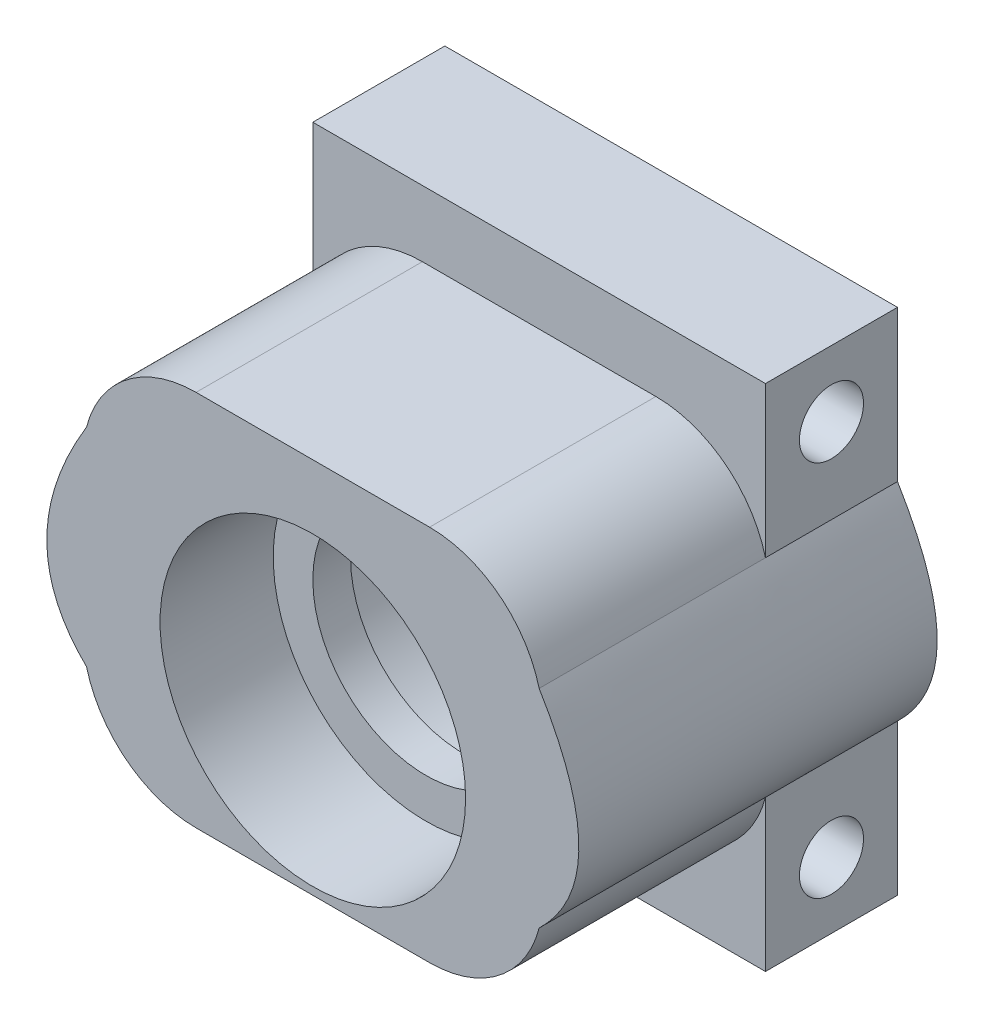
from build123d import *

# Parameters (mm, degrees)
SKETCH1_W            = 24
SKETCH1_H            = 3.5
SKETCH1_R            = 8.1
BOSS_EXTRUDE1_DEPTH  = 7
BOSS_EXTRUDE2_START  = 7
SKETCH1_3_R          = 8.1
BOSS_EXTRUDE2_DEPTH  = 12
M3_CLEARANCE_HOLE1_D = 3.4
FILLET1_R            = 6
BOSS_EXTRUDE3_START  = 11
SKETCH1_4_R          = 8.1
SKETCH1_4_R_2        = 6
BOSS_EXTRUDE3_DEPTH  = 2


with BuildPart() as part:
    # Sketch1 → Boss-Extrude1 (new body)
    # profile 1 of 5: a face of its own
    with BuildSketch(Plane.XY):
        with Locations((0, 11.75)):
            Rectangle(SKETCH1_W, SKETCH1_H)
    # profile 2 of 5: a face of its own
    with BuildSketch(Plane.XY):
        with BuildLine():
            Line((-10, 10), (-12, 10))
            Line((-12, 10), (-12, 5.5))
            add(Edge.make_bspline(
                [(-12, 5.5), (-16.208168435, -1.452739177), (-12, -5.5)],
                knots=[0, 0, 0, 0.703674115, 0.703674115, 0.703674115], degree=2))
            Line((-12, -5.5), (-12, -10))
            Line((-12, -10), (-10, -10))
            Line((-10, -10), (-10, -5.5))
            add(Edge.make_bspline(
                [(-10, 5.5), (-13.144989471, -1.593519523), (-10, -5.5)],
                knots=[0, 0, 0, 0.703674115, 0.703674115, 0.703674115], degree=2))
            Line((-10, 5.5), (-10, 10))
        make_face()
    # profile 3 of 5: a face of its own
    with BuildSketch(Plane.XY):
        with BuildLine():
            Line((12, 5.5), (12, 10))
            Line((12, 10), (10, 10))
            Line((10, 10), (10, 5.5))
            add(Edge.make_bspline(
                [(10, 5.5), (13.144989471, -1.593519523), (10, -5.5)],
                knots=[0, 0, 0, 0.703674115, 0.703674115, 0.703674115], degree=2))
            Line((10, -5.5), (10, -10))
            Line((10, -10), (12, -10))
            Line((12, -10), (12, -5.5))
            add(Edge.make_bspline(
                [(12, 5.5), (16.208168435, -1.452739177), (12, -5.5)],
                knots=[0, 0, 0, 0.703674115, 0.703674115, 0.703674115], degree=2))
        make_face()
    # profile 4 of 5: a face of its own
    with BuildSketch(Plane.XY):
        with BuildLine():
            Line((-10, -10), (-12, -10))
            Line((-12, -10), (-12, -13.5))
            Line((-12, -13.5), (12, -13.5))
            Line((12, -13.5), (12, -10))
            Line((12, -10), (10, -10))
            Line((10, -10), (5.934098246, -10))
            add(Edge.make_bspline(
                [(5.934098246, -10), (5.478588927, -10.00932896), (0, -10)],
                knots=[0.968742805, 0.968742805, 0.968742805, 1, 1, 1], degree=2))
            Line((0, -10), (-10, -10))
        make_face()
    # profile 5 of 5: a face of its own
    with BuildSketch(Plane.XY):
        with BuildLine():
            Line((10, 10), (-10, 10))
            Line((-10, 10), (-10, 5.5))
            add(Edge.make_bspline(
                [(-10, 5.5), (-13.144989471, -1.593519523), (-10, -5.5)],
                knots=[0, 0, 0, 0.703674115, 0.703674115, 0.703674115], degree=2))
            Line((-10, -5.5), (-10, -10))
            Line((-10, -10), (0, -10))
            Line((0, -10), (5.934098246, -10))
            Line((5.934098246, -10), (10, -10))
            Line((10, -10), (10, -5.5))
            add(Edge.make_bspline(
                [(10, 5.5), (13.144989471, -1.593519523), (10, -5.5)],
                knots=[0, 0, 0, 0.703674115, 0.703674115, 0.703674115], degree=2))
            Line((10, 5.5), (10, 10))
        make_face()
        with Locations((0, -1.5)):
            Circle(SKETCH1_R, mode=Mode.SUBTRACT)
    extrude(amount=BOSS_EXTRUDE1_DEPTH)

    # Sketch1<3> → Boss-Extrude2 (add)
    with BuildSketch(Plane.XY.offset(BOSS_EXTRUDE2_START)):
        with BuildLine():
            Line((-12, 10), (-12, 5.5))
            add(Edge.make_bspline(
                [(-12, 5.5), (-16.208168435, -1.452739177), (-12, -5.5)],
                knots=[0, 0, 0, 0.703674115, 0.703674115, 0.703674115], degree=2))
            Line((-12, -5.5), (-12, -10))
            Line((-12, -10), (12, -10))
            Line((12, -10), (12, -5.5))
            add(Edge.make_bspline(
                [(12, 5.5), (16.208168435, -1.452739177), (12, -5.5)],
                knots=[0, 0, 0, 0.703674115, 0.703674115, 0.703674115], degree=2))
            Line((12, 5.5), (12, 10))
            Line((12, 10), (-12, 10))
        make_face()
        with Locations((0, -1.5)):
            Circle(SKETCH1_3_R, mode=Mode.SUBTRACT)
    extrude(amount=BOSS_EXTRUDE2_DEPTH)

    # M3 Clearance Hole1 (through all)
    with Locations(Plane.ZY.offset(12)):
        with Locations((3.5, 10), (3.5, -10)):
            Hole(M3_CLEARANCE_HOLE1_D / 2)

    # Fillet1
    # the kernel refuses this fillet: 6 mm, written as the material it takes off along each edge
    with BuildSketch(Plane(origin=(-12, 10, 7), x_dir=(1, 0, 0), z_dir=(0, 0, 1))) as fillet1_piece_1:
        with BuildLine():
            CenterArc((5.809475019, -6), FILLET1_R, 90, 75.522487814)
            Line((0, -4.5), (0, 0))
            Line((0, 0), (5.809475019, 0))
        make_face()
    extrude(amount=26.523687548, mode=Mode.SUBTRACT)
    with BuildSketch(Plane(origin=(12, 10, 7), x_dir=(0, -1, 0), z_dir=(0, 0, 1)), Plane(origin=(-12, -10, 7), x_dir=(0, 1, 0), z_dir=(0, 0, 1))) as fillet1_piece_2:
        with BuildLine():
            CenterArc((6, -5.809475019), FILLET1_R, 104.477512186, 75.522487814)
            Line((0, -5.809475019), (0, 0))
            Line((0, 0), (4.5, 0))
        make_face()
    extrude(amount=26.523687548, mode=Mode.SUBTRACT)
    with BuildSketch(Plane(origin=(12, -10, 7), x_dir=(0, 1, 0), z_dir=(0, 0, 1))) as fillet1_piece_3:
        with BuildLine():
            CenterArc((6, 5.809475019), FILLET1_R, 180, 75.522487814)
            Line((0, 5.809475019), (0, 0))
            Line((0, 0), (4.5, 0))
        make_face()
    extrude(amount=26.523687548, mode=Mode.SUBTRACT)

    # Sketch1<4> → Boss-Extrude3 (add)
    with BuildSketch(Plane.XY.offset(BOSS_EXTRUDE3_START)):
        with Locations((0, -1.5)):
            Circle(SKETCH1_4_R)
        with Locations((0, -1.5)):
            Circle(SKETCH1_4_R_2, mode=Mode.SUBTRACT)
    extrude(amount=BOSS_EXTRUDE3_DEPTH)

    # Fillet2: read off the stored shape, not the designer's step
    # Fillet2 outline → Fillet2 (revolve, cut)
    with BuildSketch(Plane.XZ.offset(1.5)):
        with BuildLine():
            ThreePointArc((10.1, 0), (8.685786438, 0.585786438), (8.1, 2))
            Line((8.1, 2), (8.1, 0))
            Line((8.1, 0), (10.1, 0))
        make_face()
    revolve(axis=Axis((0, -1.5, 0), (0, 0, 1)), mode=Mode.SUBTRACT)


solid = part.part
